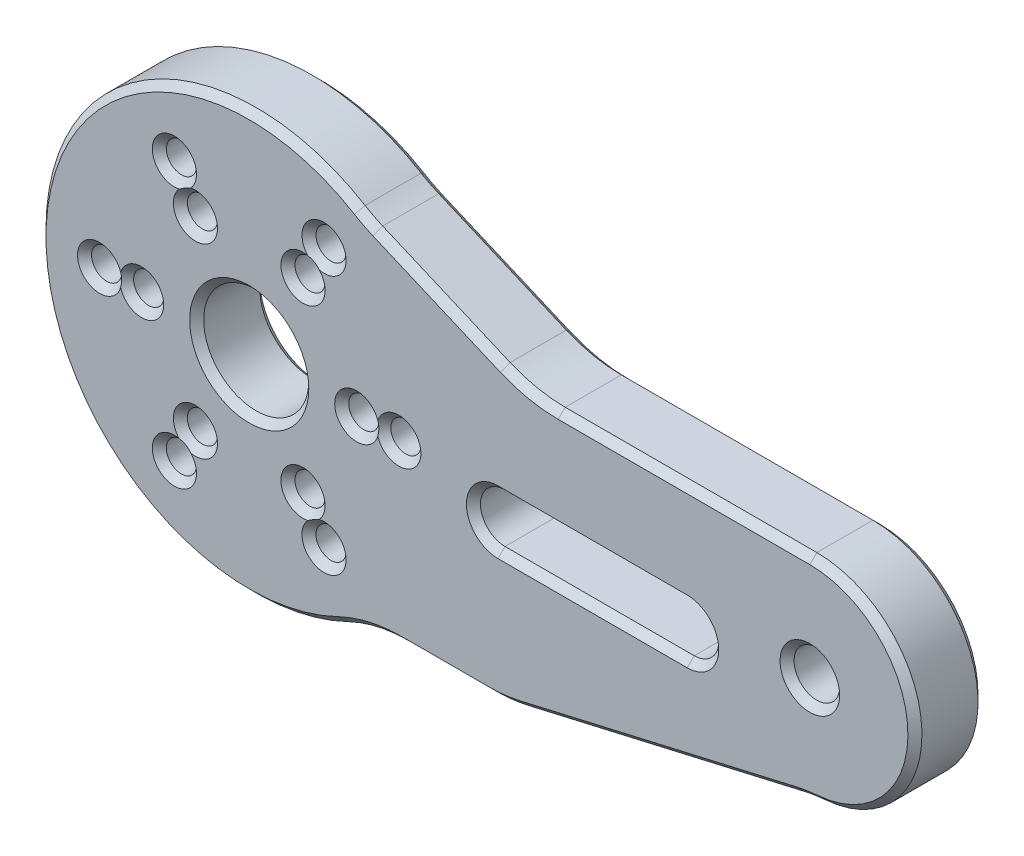
from build123d import *

# Parameters (mm, degrees)
SKETCH_1_R      = 1.625
SKETCH_1_R_2    = 1.075
SKETCH_1_R_3    = 3.75
EXTRUDE_1_DEPTH = 5
CHAMFER_1_SIZE  = 0.5


with BuildPart() as part:
    # 草图1 → 凸台-拉伸1 (new body)
    with BuildSketch(Plane.XY):
        with BuildLine():
            Line((3.149303722, -12.244859178), (22.87540528, -7.701441191))
            ThreePointArc((22.87540528, -7.701441191), (23.602096065, -7.562156693), (24.337096473, -7.476985872))
            ThreePointArc((24.337096473, -7.476985872), (31.244244259, 0.293773688), (23.75, 7.5))
            Line((23.75, 7.5), (5.795843442, 7.5))
            ThreePointArc((5.795843442, 7.5), (3.791515378, 7.702925487), (1.868533163, 8.303466198))
            Line((1.868533163, 8.303466198), (-7.226166746, 12.187289083))
            ThreePointArc((-7.226166746, 12.187289083), (-7.864075172, 12.486700981), (-8.47931388, 12.830293731))
            ThreePointArc((-8.47931388, 12.830293731), (-31.23359801, 0.701277888), (-9.711651585, -13.5))
            ThreePointArc((-9.711651585, -13.5), (-7.588820619, -12.753205655), (-5.352752641, -12.5))
            Line((-5.352752641, -12.5), (0.904817231, -12.5))
            ThreePointArc((0.904817231, -12.5), (2.034287953, -12.436010059), (3.149303722, -12.244859178))
        make_face()
        with Locations((23.75, 0)):
            Circle(SKETCH_1_R, mode=Mode.SUBTRACT)
        with Locations((-5.575, 0)):
            Circle(SKETCH_1_R_2, mode=Mode.SUBTRACT)
        with Locations((-8.575, 0)):
            Circle(SKETCH_1_R_2, mode=Mode.SUBTRACT)
        with Locations((-16.25, 0)):
            Circle(SKETCH_1_R_3, mode=Mode.SUBTRACT)
        with Locations((-12.4125, -6.646744974)):
            Circle(SKETCH_1_R_2, mode=Mode.SUBTRACT)
        with Locations((-10.9125, -9.244821185)):
            Circle(SKETCH_1_R_2, mode=Mode.SUBTRACT)
        with Locations((-20.0875, -6.646744974)):
            Circle(SKETCH_1_R_2, mode=Mode.SUBTRACT)
        with Locations((-21.5875, -9.244821185)):
            Circle(SKETCH_1_R_2, mode=Mode.SUBTRACT)
        with Locations((-23.925, 0)):
            Circle(SKETCH_1_R_2, mode=Mode.SUBTRACT)
        with Locations((-26.925, 0)):
            Circle(SKETCH_1_R_2, mode=Mode.SUBTRACT)
        with Locations((-20.0875, 6.646744974)):
            Circle(SKETCH_1_R_2, mode=Mode.SUBTRACT)
        with Locations((-21.5875, 9.244821185)):
            Circle(SKETCH_1_R_2, mode=Mode.SUBTRACT)
        with Locations((-12.4125, 6.646744974)):
            Circle(SKETCH_1_R_2, mode=Mode.SUBTRACT)
        with Locations((-10.9125, 9.244821185)):
            Circle(SKETCH_1_R_2, mode=Mode.SUBTRACT)
        with BuildLine():
            Line((15, 0.25), (1.5, 0.25))
            ThreePointArc((1.5, 0.25), (-0.25, -1.5), (1.5, -3.25))
            Line((1.5, -3.25), (15, -3.25))
            ThreePointArc((15, -3.25), (16.75, -1.5), (15, 0.25))
        make_face(mode=Mode.SUBTRACT)
    extrude(amount=EXTRUDE_1_DEPTH)

    # 倒角1
    # the kernel refuses this chamfer: 0.5 mm, written as the material it takes off along each edge
    with BuildSketch(Plane(origin=(25.119891771, -17.446300368, 0), x_dir=(-0.22444864911000906, 0.9744859177600731, 0), z_dir=(-0.9744859177600731, -0.22444864911000906, 0))) as chamfer_1_piece_1:
        Polygon((10, -CHAMFER_1_SIZE), (10 + CHAMFER_1_SIZE, 0), (10, 0), align=None)
    revolve(axis=Axis((25.119891771, -17.446300368, 0), (0, 0, -1)), revolution_arc=8.480778987, mode=Mode.SUBTRACT)
    with BuildSketch(Plane(origin=(3.149303722, -12.244859178, 0), x_dir=(0.006171412361341669, -0.02679434455348423, 0.9996219169112968), z_dir=(0.9744859177600713, 0.22444864911001733, 0))) as chamfer_1_piece_2:
        Polygon((CHAMFER_1_SIZE * 0.999621916911, -CHAMFER_1_SIZE * 0.0274958766106), (-CHAMFER_1_SIZE * 0.0274958766106, -CHAMFER_1_SIZE * 0.999621916911), (0, 0), align=None)
    extrude(amount=20.24257221, mode=Mode.SUBTRACT)
    with BuildSketch(Plane(origin=(0.904817231, -2.5, 0), x_dir=(0, -1, 0), z_dir=(-1, 0, 0))) as chamfer_1_piece_3:
        Polygon((10, CHAMFER_1_SIZE), (10 - CHAMFER_1_SIZE, 0), (10, 0), align=None)
    revolve(axis=Axis((0.904817231, -2.5, 0), (0, 0, 1)), revolution_arc=12.970458875, mode=Mode.SUBTRACT)
    with BuildSketch(Plane(origin=(-5.352752641, -12.5, 0), x_dir=(0, -0.02749587661058563, 0.9996219169112968), z_dir=(1, 0, 0))) as chamfer_1_piece_4:
        Polygon((CHAMFER_1_SIZE * 0.999621916911, -CHAMFER_1_SIZE * 0.0274958766106), (-CHAMFER_1_SIZE * 0.0274958766106, -CHAMFER_1_SIZE * 0.999621916911), (0, 0), align=None)
    extrude(amount=6.257569872, mode=Mode.SUBTRACT)
    with BuildSketch(Plane(origin=(-5.352752641, -22.5, 0), x_dir=(-0.43588989435407066, 0.8999999999999984, 0), z_dir=(-0.8999999999999984, -0.43588989435407066, 0))) as chamfer_1_piece_5:
        Polygon((10, -CHAMFER_1_SIZE), (10 + CHAMFER_1_SIZE, 0), (10, 0), align=None)
    revolve(axis=Axis((-5.352752641, -22.5, 0), (0, 0, -1)), revolution_arc=25.841932763, mode=Mode.SUBTRACT)
    with BuildSketch(Plane(origin=(5.795843442, 17.5, 5), x_dir=(0, -1, 0), z_dir=(1, 0, 0))) as chamfer_1_piece_6:
        Polygon((10, CHAMFER_1_SIZE), (10 + CHAMFER_1_SIZE, 0), (10, 0), align=None)
    revolve(axis=Axis((5.795843442, 17.5, 5), (0, 0, -1)), revolution_arc=23.124539022, mode=Mode.SUBTRACT)
    with BuildSketch(Plane(origin=(-16.25, 0, 0), x_dir=(0.5180457413501507, 0.8553529153916369, 0), z_dir=(0.8553529153916369, -0.5180457413501507, 0))) as chamfer_1_piece_7:
        Polygon((15, CHAMFER_1_SIZE), (15 - CHAMFER_1_SIZE, 0), (15, 0), align=None)
    revolve(axis=Axis((-16.25, 0, 0), (0, 0, 1)), revolution_arc=237.043187516, mode=Mode.SUBTRACT)
    with BuildSketch(Plane(origin=(-3.298856466, 21.383822885, 0), x_dir=(-0.3927310279518563, -0.9196533801840117, 0), z_dir=(0.9196533801840117, -0.3927310279518563, 0))) as chamfer_1_piece_8:
        Polygon((10, -CHAMFER_1_SIZE), (10 + CHAMFER_1_SIZE, 0), (10, 0), align=None)
    revolve(axis=Axis((-3.298856466, 21.383822885, 0), (0, 0, -1)), revolution_arc=8.07671573, mode=Mode.SUBTRACT)
    with BuildSketch(Plane(origin=(1.868533163, 8.303466198, 0), x_dir=(0.01079848388571308, 0.025286675866047652, 0.9996219169112968), z_dir=(-0.919653380184007, 0.39273102795186715, 0))) as chamfer_1_piece_9:
        Polygon((CHAMFER_1_SIZE * 0.999621916911, -CHAMFER_1_SIZE * 0.0274958766106), (-CHAMFER_1_SIZE * 0.0274958766106, -CHAMFER_1_SIZE * 0.999621916911), (0, 0), align=None)
    extrude(amount=9.889269267, mode=Mode.SUBTRACT)
    with BuildSketch(Plane(origin=(5.795843442, 17.5, 0), x_dir=(0, -1, 0), z_dir=(1, 0, 0))) as chamfer_1_piece_10:
        Polygon((10, -CHAMFER_1_SIZE), (10 + CHAMFER_1_SIZE, 0), (10, 0), align=None)
    revolve(axis=Axis((5.795843442, 17.5, 0), (0, 0, -1)), revolution_arc=23.124539022, mode=Mode.SUBTRACT)
    with BuildSketch(Plane(origin=(23.75, 7.5, 0), x_dir=(0, 0.02749587661058563, 0.9996219169112968), z_dir=(-1, 0, 0))) as chamfer_1_piece_11:
        Polygon((CHAMFER_1_SIZE * 0.999621916911, -CHAMFER_1_SIZE * 0.0274958766106), (-CHAMFER_1_SIZE * 0.0274958766106, -CHAMFER_1_SIZE * 0.999621916911), (0, 0), align=None)
    extrude(amount=17.954156558, mode=Mode.SUBTRACT)
    with BuildSketch(Plane(origin=(23.75, 0, 0), x_dir=(0.07827952977032453, -0.9969314496087165, 0), z_dir=(-0.9969314496087165, -0.07827952977032453, 0))) as chamfer_1_piece_12:
        Polygon((7.5, CHAMFER_1_SIZE), (7.5 - CHAMFER_1_SIZE, 0), (7.5, 0), align=None)
    revolve(axis=Axis((23.75, 0, 0), (0, 0, 1)), revolution_arc=175.510320112, mode=Mode.SUBTRACT)
    with BuildSketch(Plane(origin=(1.868533163, 8.303466198, 5), x_dir=(0.010798483885713087, 0.02528667586604767, -0.9996219169112968), z_dir=(-0.919653380184007, 0.39273102795186715, 0))) as chamfer_1_piece_13:
        Polygon((CHAMFER_1_SIZE * 0.999621916911, CHAMFER_1_SIZE * 0.0274958766106), (-CHAMFER_1_SIZE * 0.0274958766106, CHAMFER_1_SIZE * 0.999621916911), (0, 0), align=None)
    extrude(amount=9.889269267, mode=Mode.SUBTRACT)
    with BuildSketch(Plane(origin=(-3.298856466, 21.383822885, 5), x_dir=(-0.3927310279518563, -0.9196533801840117, 0), z_dir=(0.9196533801840117, -0.3927310279518563, 0))) as chamfer_1_piece_14:
        Polygon((10, CHAMFER_1_SIZE), (10 + CHAMFER_1_SIZE, 0), (10, 0), align=None)
    revolve(axis=Axis((-3.298856466, 21.383822885, 5), (0, 0, -1)), revolution_arc=8.07671573, mode=Mode.SUBTRACT)
    with BuildSketch(Plane(origin=(-16.25, 0, 5), x_dir=(0.5180457413501507, 0.8553529153916369, 0), z_dir=(0.8553529153916369, -0.5180457413501507, 0))) as chamfer_1_piece_15:
        Polygon((15, -CHAMFER_1_SIZE), (15 - CHAMFER_1_SIZE, 0), (15, 0), align=None)
    revolve(axis=Axis((-16.25, 0, 5), (0, 0, 1)), revolution_arc=237.043187516, mode=Mode.SUBTRACT)
    with BuildSketch(Plane(origin=(-5.352752641, -22.5, 5), x_dir=(-0.43588989435407066, 0.8999999999999984, 0), z_dir=(-0.8999999999999984, -0.43588989435407066, 0))) as chamfer_1_piece_16:
        Polygon((10, CHAMFER_1_SIZE), (10 + CHAMFER_1_SIZE, 0), (10, 0), align=None)
    revolve(axis=Axis((-5.352752641, -22.5, 5), (0, 0, -1)), revolution_arc=25.841932763, mode=Mode.SUBTRACT)
    with BuildSketch(Plane(origin=(1.5, -1.5, 0), x_dir=(0, 1, 0), z_dir=(1, 0, 0))) as chamfer_1_piece_17:
        Polygon((1.75, CHAMFER_1_SIZE), (1.75 + CHAMFER_1_SIZE, 0), (1.75, 0), align=None)
    revolve(axis=Axis((1.5, -1.5, 0), (0, 0, 1)), revolution_arc=180, mode=Mode.SUBTRACT)
    with BuildSketch(Plane(origin=(1.5, -3.25, 0), x_dir=(0, 0.027495876610586494, 0.9996219169112968), z_dir=(1, 0, 0)), Plane(origin=(15, 0.25, 0), x_dir=(0, -0.027495876610586382, 0.9996219169112968), z_dir=(-1, 0, 0))) as chamfer_1_piece_18:
        Polygon((CHAMFER_1_SIZE * 0.999621916911, CHAMFER_1_SIZE * 0.0274958766106), (-CHAMFER_1_SIZE * 0.0274958766106, CHAMFER_1_SIZE * 0.999621916911), (0, 0), align=None)
    extrude(amount=13.5, mode=Mode.SUBTRACT)
    with BuildSketch(Plane(origin=(15, -1.5, 0), x_dir=(0, -1, 0), z_dir=(-1, 0, 0))) as chamfer_1_piece_19:
        Polygon((1.75, CHAMFER_1_SIZE), (1.75 + CHAMFER_1_SIZE, 0), (1.75, 0), align=None)
    revolve(axis=Axis((15, -1.5, 0), (0, 0, 1)), revolution_arc=180, mode=Mode.SUBTRACT)
    with BuildSketch(Plane(origin=(-5.352752641, -12.5, 5), x_dir=(0, -0.027495876610585647, -0.9996219169112968), z_dir=(1, 0, 0))) as chamfer_1_piece_20:
        Polygon((CHAMFER_1_SIZE * 0.999621916911, CHAMFER_1_SIZE * 0.0274958766106), (-CHAMFER_1_SIZE * 0.0274958766106, CHAMFER_1_SIZE * 0.999621916911), (0, 0), align=None)
    extrude(amount=6.257569872, mode=Mode.SUBTRACT)
    with BuildSketch(Plane(origin=(1.5, -1.5, 5), x_dir=(0, 1, 0), z_dir=(1, 0, 0))) as chamfer_1_piece_21:
        Polygon((1.75, -CHAMFER_1_SIZE), (1.75 + CHAMFER_1_SIZE, 0), (1.75, 0), align=None)
    revolve(axis=Axis((1.5, -1.5, 5), (0, 0, 1)), revolution_arc=180, mode=Mode.SUBTRACT)
    with BuildSketch(Plane(origin=(1.5, -3.25, 5), x_dir=(0, 0.02749587661058651, -0.9996219169112968), z_dir=(1, 0, 0)), Plane(origin=(15, 0.25, 5), x_dir=(0, -0.027495876610586403, -0.9996219169112968), z_dir=(-1, 0, 0))) as chamfer_1_piece_22:
        Polygon((CHAMFER_1_SIZE * 0.999621916911, -CHAMFER_1_SIZE * 0.0274958766106), (-CHAMFER_1_SIZE * 0.0274958766106, -CHAMFER_1_SIZE * 0.999621916911), (0, 0), align=None)
    extrude(amount=13.5, mode=Mode.SUBTRACT)
    with BuildSketch(Plane(origin=(15, -1.5, 5), x_dir=(0, -1, 0), z_dir=(-1, 0, 0))) as chamfer_1_piece_23:
        Polygon((1.75, -CHAMFER_1_SIZE), (1.75 + CHAMFER_1_SIZE, 0), (1.75, 0), align=None)
    revolve(axis=Axis((15, -1.5, 5), (0, 0, 1)), revolution_arc=180, mode=Mode.SUBTRACT)
    with BuildSketch(Plane(origin=(0.904817231, -2.5, 5), x_dir=(0, -1, 0), z_dir=(-1, 0, 0))) as chamfer_1_piece_24:
        Polygon((10, -CHAMFER_1_SIZE), (10 - CHAMFER_1_SIZE, 0), (10, 0), align=None)
    revolve(axis=Axis((0.904817231, -2.5, 5), (0, 0, 1)), revolution_arc=12.970458875, mode=Mode.SUBTRACT)
    with BuildSketch(Plane(origin=(3.149303722, -12.244859178, 5), x_dir=(0.006171412361341674, -0.02679434455348425, -0.9996219169112968), z_dir=(0.9744859177600713, 0.22444864911001733, 0))) as chamfer_1_piece_25:
        Polygon((CHAMFER_1_SIZE * 0.999621916911, CHAMFER_1_SIZE * 0.0274958766106), (-CHAMFER_1_SIZE * 0.0274958766106, CHAMFER_1_SIZE * 0.999621916911), (0, 0), align=None)
    extrude(amount=20.24257221, mode=Mode.SUBTRACT)
    with BuildSketch(Plane(origin=(23.75, 0, 0), x_dir=(1, 0, 0), z_dir=(0, -1, 0))) as chamfer_1_piece_26:
        Polygon((1.625, CHAMFER_1_SIZE), (1.625 + CHAMFER_1_SIZE, 0), (1.625, 0), align=None)
    revolve(axis=Axis((23.75, 0, 0), (0, 0, 1)), mode=Mode.SUBTRACT)
    with BuildSketch(Plane(origin=(23.75, 0, 5), x_dir=(1, 0, 0), z_dir=(0, -1, 0))) as chamfer_1_piece_27:
        Polygon((1.625, -CHAMFER_1_SIZE), (1.625 + CHAMFER_1_SIZE, 0), (1.625, 0), align=None)
    revolve(axis=Axis((23.75, 0, 5), (0, 0, 1)), mode=Mode.SUBTRACT)
    with BuildSketch(Plane(origin=(25.119891771, -17.446300368, 5), x_dir=(-0.22444864911000906, 0.9744859177600731, 0), z_dir=(-0.9744859177600731, -0.22444864911000906, 0))) as chamfer_1_piece_28:
        Polygon((10, CHAMFER_1_SIZE), (10 + CHAMFER_1_SIZE, 0), (10, 0), align=None)
    revolve(axis=Axis((25.119891771, -17.446300368, 5), (0, 0, -1)), revolution_arc=8.480778987, mode=Mode.SUBTRACT)
    with BuildSketch(Plane(origin=(-5.575, 0, 0), x_dir=(1, 0, 0), z_dir=(0, -1, 0))) as chamfer_1_piece_29:
        Polygon((1.075, CHAMFER_1_SIZE), (1.075 + CHAMFER_1_SIZE, 0), (1.075, 0), align=None)
    revolve(axis=Axis((-5.575, 0, 0), (0, 0, 1)), mode=Mode.SUBTRACT)
    with BuildSketch(Plane(origin=(-5.575, 0, 5), x_dir=(1, 0, 0), z_dir=(0, -1, 0))) as chamfer_1_piece_30:
        Polygon((1.075, -CHAMFER_1_SIZE), (1.075 + CHAMFER_1_SIZE, 0), (1.075, 0), align=None)
    revolve(axis=Axis((-5.575, 0, 5), (0, 0, 1)), mode=Mode.SUBTRACT)
    with BuildSketch(Plane(origin=(-8.575, 0, 0), x_dir=(1, 0, 0), z_dir=(0, -1, 0))) as chamfer_1_piece_31:
        Polygon((1.075, CHAMFER_1_SIZE), (1.075 + CHAMFER_1_SIZE, 0), (1.075, 0), align=None)
    revolve(axis=Axis((-8.575, 0, 0), (0, 0, 1)), mode=Mode.SUBTRACT)
    with BuildSketch(Plane(origin=(-8.575, 0, 5), x_dir=(1, 0, 0), z_dir=(0, -1, 0))) as chamfer_1_piece_32:
        Polygon((1.075, -CHAMFER_1_SIZE), (1.075 + CHAMFER_1_SIZE, 0), (1.075, 0), align=None)
    revolve(axis=Axis((-8.575, 0, 5), (0, 0, 1)), mode=Mode.SUBTRACT)
    with BuildSketch(Plane(origin=(23.75, 0, 5), x_dir=(0.07827952977032453, -0.9969314496087165, 0), z_dir=(-0.9969314496087165, -0.07827952977032453, 0))) as chamfer_1_piece_33:
        Polygon((7.5, -CHAMFER_1_SIZE), (7.5 - CHAMFER_1_SIZE, 0), (7.5, 0), align=None)
    revolve(axis=Axis((23.75, 0, 5), (0, 0, 1)), revolution_arc=175.510320112, mode=Mode.SUBTRACT)
    with BuildSketch(Plane(origin=(-16.25, 0, 0), x_dir=(1, 0, 0), z_dir=(0, -1, 0))) as chamfer_1_piece_34:
        Polygon((3.75, CHAMFER_1_SIZE), (3.75 + CHAMFER_1_SIZE, 0), (3.75, 0), align=None)
    revolve(axis=Axis((-16.25, 0, 0), (0, 0, 1)), mode=Mode.SUBTRACT)
    with BuildSketch(Plane(origin=(-16.25, 0, 5), x_dir=(1, 0, 0), z_dir=(0, -1, 0))) as chamfer_1_piece_35:
        Polygon((3.75, -CHAMFER_1_SIZE), (3.75 + CHAMFER_1_SIZE, 0), (3.75, 0), align=None)
    revolve(axis=Axis((-16.25, 0, 5), (0, 0, 1)), mode=Mode.SUBTRACT)
    with BuildSketch(Plane(origin=(-12.4125, -6.646744974, 0), x_dir=(1, 0, 0), z_dir=(0, -1, 0))) as chamfer_1_piece_36:
        Polygon((1.075, CHAMFER_1_SIZE), (1.075 + CHAMFER_1_SIZE, 0), (1.075, 0), align=None)
    revolve(axis=Axis((-12.4125, -6.646744974, 0), (0, 0, 1)), mode=Mode.SUBTRACT)
    with BuildSketch(Plane(origin=(-12.4125, -6.646744974, 5), x_dir=(1, 0, 0), z_dir=(0, -1, 0))) as chamfer_1_piece_37:
        Polygon((1.075, -CHAMFER_1_SIZE), (1.075 + CHAMFER_1_SIZE, 0), (1.075, 0), align=None)
    revolve(axis=Axis((-12.4125, -6.646744974, 5), (0, 0, 1)), mode=Mode.SUBTRACT)
    with BuildSketch(Plane(origin=(-10.9125, -9.244821185, 0), x_dir=(1, 0, 0), z_dir=(0, -1, 0))) as chamfer_1_piece_38:
        Polygon((1.075, CHAMFER_1_SIZE), (1.075 + CHAMFER_1_SIZE, 0), (1.075, 0), align=None)
    revolve(axis=Axis((-10.9125, -9.244821185, 0), (0, 0, 1)), mode=Mode.SUBTRACT)
    with BuildSketch(Plane(origin=(-10.9125, -9.244821185, 5), x_dir=(1, 0, 0), z_dir=(0, -1, 0))) as chamfer_1_piece_39:
        Polygon((1.075, -CHAMFER_1_SIZE), (1.075 + CHAMFER_1_SIZE, 0), (1.075, 0), align=None)
    revolve(axis=Axis((-10.9125, -9.244821185, 5), (0, 0, 1)), mode=Mode.SUBTRACT)
    with BuildSketch(Plane(origin=(-20.0875, -6.646744974, 0), x_dir=(1, 0, 0), z_dir=(0, -1, 0))) as chamfer_1_piece_40:
        Polygon((1.075, CHAMFER_1_SIZE), (1.075 + CHAMFER_1_SIZE, 0), (1.075, 0), align=None)
    revolve(axis=Axis((-20.0875, -6.646744974, 0), (0, 0, 1)), mode=Mode.SUBTRACT)
    with BuildSketch(Plane(origin=(-20.0875, -6.646744974, 5), x_dir=(1, 0, 0), z_dir=(0, -1, 0))) as chamfer_1_piece_41:
        Polygon((1.075, -CHAMFER_1_SIZE), (1.075 + CHAMFER_1_SIZE, 0), (1.075, 0), align=None)
    revolve(axis=Axis((-20.0875, -6.646744974, 5), (0, 0, 1)), mode=Mode.SUBTRACT)
    with BuildSketch(Plane(origin=(-21.5875, -9.244821185, 0), x_dir=(1, 0, 0), z_dir=(0, -1, 0))) as chamfer_1_piece_42:
        Polygon((1.075, CHAMFER_1_SIZE), (1.075 + CHAMFER_1_SIZE, 0), (1.075, 0), align=None)
    revolve(axis=Axis((-21.5875, -9.244821185, 0), (0, 0, 1)), mode=Mode.SUBTRACT)
    with BuildSketch(Plane(origin=(-21.5875, -9.244821185, 5), x_dir=(1, 0, 0), z_dir=(0, -1, 0))) as chamfer_1_piece_43:
        Polygon((1.075, -CHAMFER_1_SIZE), (1.075 + CHAMFER_1_SIZE, 0), (1.075, 0), align=None)
    revolve(axis=Axis((-21.5875, -9.244821185, 5), (0, 0, 1)), mode=Mode.SUBTRACT)
    with BuildSketch(Plane(origin=(-23.925, 0, 0), x_dir=(1, 0, 0), z_dir=(0, -1, 0))) as chamfer_1_piece_44:
        Polygon((1.075, CHAMFER_1_SIZE), (1.075 + CHAMFER_1_SIZE, 0), (1.075, 0), align=None)
    revolve(axis=Axis((-23.925, 0, 0), (0, 0, 1)), mode=Mode.SUBTRACT)
    with BuildSketch(Plane(origin=(-23.925, 0, 5), x_dir=(1, 0, 0), z_dir=(0, -1, 0))) as chamfer_1_piece_45:
        Polygon((1.075, -CHAMFER_1_SIZE), (1.075 + CHAMFER_1_SIZE, 0), (1.075, 0), align=None)
    revolve(axis=Axis((-23.925, 0, 5), (0, 0, 1)), mode=Mode.SUBTRACT)
    with BuildSketch(Plane(origin=(-26.925, 0, 0), x_dir=(1, 0, 0), z_dir=(0, -1, 0))) as chamfer_1_piece_46:
        Polygon((1.075, CHAMFER_1_SIZE), (1.075 + CHAMFER_1_SIZE, 0), (1.075, 0), align=None)
    revolve(axis=Axis((-26.925, 0, 0), (0, 0, 1)), mode=Mode.SUBTRACT)
    with BuildSketch(Plane(origin=(-26.925, 0, 5), x_dir=(1, 0, 0), z_dir=(0, -1, 0))) as chamfer_1_piece_47:
        Polygon((1.075, -CHAMFER_1_SIZE), (1.075 + CHAMFER_1_SIZE, 0), (1.075, 0), align=None)
    revolve(axis=Axis((-26.925, 0, 5), (0, 0, 1)), mode=Mode.SUBTRACT)
    with BuildSketch(Plane(origin=(-20.0875, 6.646744974, 0), x_dir=(1, 0, 0), z_dir=(0, -1, 0))) as chamfer_1_piece_48:
        Polygon((1.075, CHAMFER_1_SIZE), (1.075 + CHAMFER_1_SIZE, 0), (1.075, 0), align=None)
    revolve(axis=Axis((-20.0875, 6.646744974, 0), (0, 0, 1)), mode=Mode.SUBTRACT)
    with BuildSketch(Plane(origin=(-20.0875, 6.646744974, 5), x_dir=(1, 0, 0), z_dir=(0, -1, 0))) as chamfer_1_piece_49:
        Polygon((1.075, -CHAMFER_1_SIZE), (1.075 + CHAMFER_1_SIZE, 0), (1.075, 0), align=None)
    revolve(axis=Axis((-20.0875, 6.646744974, 5), (0, 0, 1)), mode=Mode.SUBTRACT)
    with BuildSketch(Plane(origin=(-21.5875, 9.244821185, 0), x_dir=(1, 0, 0), z_dir=(0, -1, 0))) as chamfer_1_piece_50:
        Polygon((1.075, CHAMFER_1_SIZE), (1.075 + CHAMFER_1_SIZE, 0), (1.075, 0), align=None)
    revolve(axis=Axis((-21.5875, 9.244821185, 0), (0, 0, 1)), mode=Mode.SUBTRACT)
    with BuildSketch(Plane(origin=(-21.5875, 9.244821185, 5), x_dir=(1, 0, 0), z_dir=(0, -1, 0))) as chamfer_1_piece_51:
        Polygon((1.075, -CHAMFER_1_SIZE), (1.075 + CHAMFER_1_SIZE, 0), (1.075, 0), align=None)
    revolve(axis=Axis((-21.5875, 9.244821185, 5), (0, 0, 1)), mode=Mode.SUBTRACT)
    with BuildSketch(Plane(origin=(-12.4125, 6.646744974, 0), x_dir=(1, 0, 0), z_dir=(0, -1, 0))) as chamfer_1_piece_52:
        Polygon((1.075, CHAMFER_1_SIZE), (1.075 + CHAMFER_1_SIZE, 0), (1.075, 0), align=None)
    revolve(axis=Axis((-12.4125, 6.646744974, 0), (0, 0, 1)), mode=Mode.SUBTRACT)
    with BuildSketch(Plane(origin=(-12.4125, 6.646744974, 5), x_dir=(1, 0, 0), z_dir=(0, -1, 0))) as chamfer_1_piece_53:
        Polygon((1.075, -CHAMFER_1_SIZE), (1.075 + CHAMFER_1_SIZE, 0), (1.075, 0), align=None)
    revolve(axis=Axis((-12.4125, 6.646744974, 5), (0, 0, 1)), mode=Mode.SUBTRACT)
    with BuildSketch(Plane(origin=(23.75, 7.5, 5), x_dir=(0, 0.027495876610585647, -0.9996219169112968), z_dir=(-1, 0, 0))) as chamfer_1_piece_54:
        Polygon((CHAMFER_1_SIZE * 0.999621916911, CHAMFER_1_SIZE * 0.0274958766106), (-CHAMFER_1_SIZE * 0.0274958766106, CHAMFER_1_SIZE * 0.999621916911), (0, 0), align=None)
    extrude(amount=17.954156558, mode=Mode.SUBTRACT)
    with BuildSketch(Plane(origin=(-10.9125, 9.244821185, 0), x_dir=(1, 0, 0), z_dir=(0, -1, 0))) as chamfer_1_piece_55:
        Polygon((1.075, CHAMFER_1_SIZE), (1.075 + CHAMFER_1_SIZE, 0), (1.075, 0), align=None)
    revolve(axis=Axis((-10.9125, 9.244821185, 0), (0, 0, 1)), mode=Mode.SUBTRACT)
    with BuildSketch(Plane(origin=(-10.9125, 9.244821185, 5), x_dir=(1, 0, 0), z_dir=(0, -1, 0))) as chamfer_1_piece_56:
        Polygon((1.075, -CHAMFER_1_SIZE), (1.075 + CHAMFER_1_SIZE, 0), (1.075, 0), align=None)
    revolve(axis=Axis((-10.9125, 9.244821185, 5), (0, 0, 1)), mode=Mode.SUBTRACT)


solid = part.part
